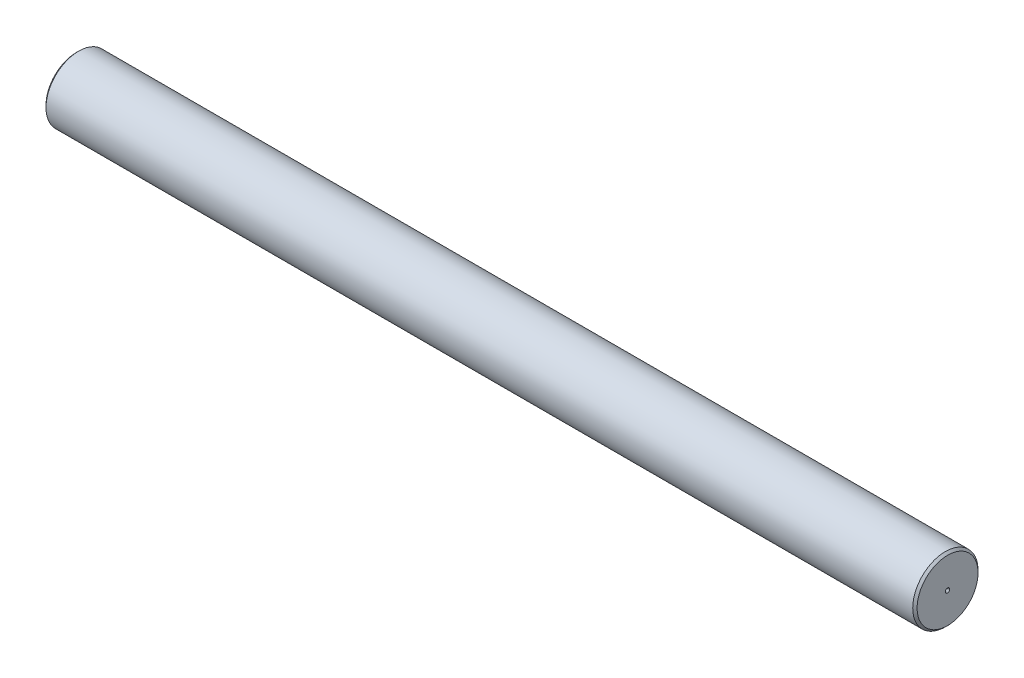
from build123d import *

# Parameters (mm, degrees)
SKETCH1_W     = 200
SKETCH1_H     = 7.5
CHAMFER1_SIZE = 0.5


with BuildPart() as part:
    # Sketch1 → Revolve1 (revolve)
    with BuildSketch(Plane.XY):
        with Locations((100, 3.75)):
            Rectangle(SKETCH1_W, SKETCH1_H)
    revolve(axis=Axis((0, 0, 0), (1, 0, 0)))

    # Sketch2 → Cut-Revolve1 (revolve, cut)
    with BuildSketch(Plane.XY):
        Polygon((0, 0.5), (0, 0), (0.5, 0), align=None)
        Polygon((199.5, 0), (200, 0.5), (200, 0), align=None)
    revolve(axis=Axis((0, 0, 0), (1, 0, 0)), mode=Mode.SUBTRACT)

    # Chamfer1
    chamfer1_edges = [part.edges().sort_by_distance(p)[0] for p in [
        (200, -7.5, 0),
        (0, -7.5, 0),
    ]]
    chamfer(chamfer1_edges, length=CHAMFER1_SIZE)


solid = part.part
